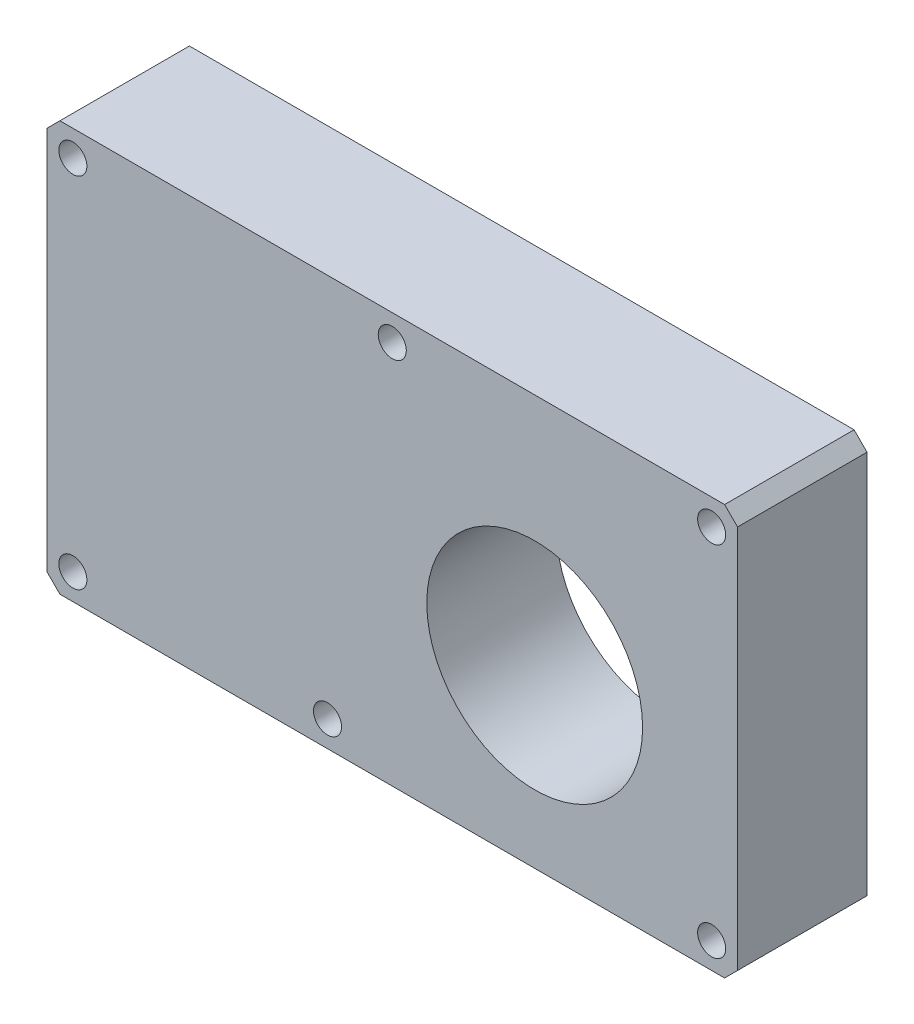
from build123d import *

# Parameters (mm, degrees)
SKETCH_1_W             = 160
SKETCH_1_H             = 95
EXTRUDE_1_DEPTH        = 30
CHAMFER_1_SIZE         = 3
SKETCH_2_R             = 25
CUT_EXTRUDE_1_DEPTH    = 189.48076825
HOLE_WIZARD_M8_1_D     = 6.8
HOLE_WIZARD_M8_1_DEPTH = 20
HOLE_WIZARD_M8_1_TIP   = 2.042926105
SKETCH_6_R             = 5.25
CUT_EXTRUDE_2_DEPTH    = 15
SKETCH_7_R             = 3.25
CUT_EXTRUDE_3_DEPTH    = 187.681547026


with BuildPart() as part:
    # 草图1 → 凸台-拉伸1 (new body)
    with BuildSketch(Plane.XY):
        with Locations((80, -47.5)):
            Rectangle(SKETCH_1_W, SKETCH_1_H)
    extrude(amount=EXTRUDE_1_DEPTH)

    # 倒角1
    chamfer_1_edges = [part.edges().sort_by_distance(p)[0] for p in [
        (160, -95, 15),
        (160, 0, 15),
        (0, -95, 15),
        (0, 0, 15),
    ]]
    chamfer(chamfer_1_edges, length=CHAMFER_1_SIZE)

    # 草图2 → 切除-拉伸1 (cut, through all)
    with BuildSketch(Plane(origin=(0, 0, 0), x_dir=(-1, 0, 0), z_dir=(0, 0, -1))):
        with Locations((-113, -54.25)):
            Circle(SKETCH_2_R)
    extrude(amount=-CUT_EXTRUDE_1_DEPTH, mode=Mode.SUBTRACT)

    # M8 螺纹孔1
    with Locations(Plane(origin=(0, 0, 0), x_dir=(-1, 0, 0), z_dir=(0, 0, -1))):
        with Locations((-143, -24.5), (-83, -24.5), (-83, -84.5), (-143, -84.5)):
            Hole(HOLE_WIZARD_M8_1_D / 2, depth=HOLE_WIZARD_M8_1_DEPTH)
            with Locations((0, 0, -(HOLE_WIZARD_M8_1_DEPTH + HOLE_WIZARD_M8_1_TIP / 2))):  # 118° drill point
                Cone(0, HOLE_WIZARD_M8_1_D / 2, HOLE_WIZARD_M8_1_TIP, mode=Mode.SUBTRACT)

    # 草图6 → 切除-拉伸2 (cut)
    with BuildSketch(Plane(origin=(0, 0, 0), x_dir=(-1, 0, 0), z_dir=(0, 0, -1))):
        with Locations((-154, -6)):
            Circle(SKETCH_6_R)
        with Locations((-80, -6)):
            Circle(SKETCH_6_R)
        with Locations((-6, -6)):
            Circle(SKETCH_6_R)
        with Locations((-6, -89)):
            Circle(SKETCH_6_R)
        with Locations((-154, -89)):
            Circle(SKETCH_6_R)
        with Locations((-65, -89)):
            Circle(SKETCH_6_R)
    extrude(amount=-CUT_EXTRUDE_2_DEPTH, mode=Mode.SUBTRACT)

    # 草图7 → 切除-拉伸3 (cut, through all)
    with BuildSketch(Plane(origin=(0, 0, 15), x_dir=(-1, 0, 0), z_dir=(0, 0, -1))):
        with Locations((-154, -6)):
            Circle(SKETCH_7_R)
        with Locations((-80, -6)):
            Circle(SKETCH_7_R)
        with Locations((-6, -6)):
            Circle(SKETCH_7_R)
        with Locations((-6, -89)):
            Circle(SKETCH_7_R)
        with Locations((-154, -89)):
            Circle(SKETCH_7_R)
        with Locations((-65, -89)):
            Circle(SKETCH_7_R)
    extrude(amount=-CUT_EXTRUDE_3_DEPTH, mode=Mode.SUBTRACT)


solid = part.part
